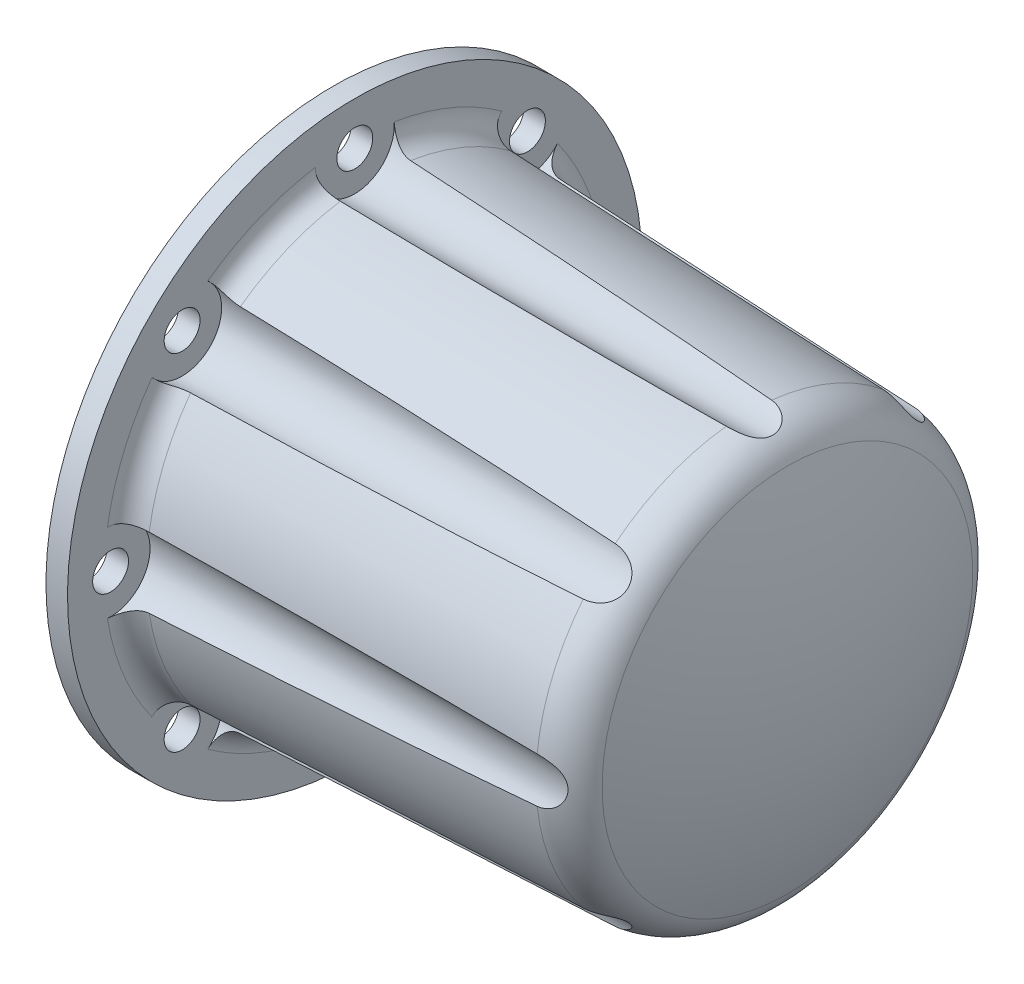
from build123d import *

# Parameters (mm, degrees)
ZAOKR_GLENIE1_R            = 3
SZKIC2_R                   = 5.5
WYTNIJ_WYCI_GNI_CIE1_DEPTH = 87.168439698
SZKIC3_R                   = 2.5
WYTNIJ_WYCI_GNI_CIE2_DEPTH = 87.168439698


with BuildPart() as part:
    # Szkic1 → Obrót1 (revolve)
    with BuildSketch(Plane.XY):
        with BuildLine():
            Line((-66, 26.5), (-10.994067388, 26.5))
            ThreePointArc((-10.994067388, 26.5), (-8.703534849, 25.77924697), (-7.238456444, 23.876730344))
            ThreePointArc((-7.238456444, 23.876730344), (-4.06783257, 12.125002732), (-3, 0))
            Line((-3, 0), (0, 0))
            ThreePointArc((0, 0), (-1.199413426, 13.121355623), (-4.757898357, 25.807795271))
            ThreePointArc((-4.757898357, 25.807795271), (-6.855963875, 28.536223134), (-10.108205234, 29.662777023))
            Line((-10.108205234, 29.662777023), (-65, 32))
            Line((-65, 32), (-65, 40))
            Line((-65, 40), (-68, 40))
            Line((-68, 40), (-68, 28.5))
            Line((-68, 28.5), (-66, 26.5))
        make_face()
    revolve(axis=Axis((-3, 0, 0), (1, 0, 0)))

    # Zaokrąglenie1
    zaokr_glenie1_edges = [part.edges().sort_by_distance(p)[0] for p in [
        (-65, -32, 0),
    ]]
    fillet(zaokr_glenie1_edges, radius=ZAOKR_GLENIE1_R)

    # Szkic2 → Wytnij-wyciągnięcie1 (cut, through all)
    with BuildSketch(Plane(origin=(-65, 0, 0), x_dir=(0, 0, -1), z_dir=(1, 0, 0))):
        with Locations((0, 34)):
            Circle(SZKIC2_R)
        with Locations((24.04163056, 24.04163056)):
            Circle(SZKIC2_R)
        with Locations((34, 0)):
            Circle(SZKIC2_R)
        with Locations((24.04163056, -24.04163056)):
            Circle(SZKIC2_R)
        with Locations((0, -34)):
            Circle(SZKIC2_R)
        with Locations((-24.04163056, -24.04163056)):
            Circle(SZKIC2_R)
        with Locations((-34, 0)):
            Circle(SZKIC2_R)
        with Locations((-24.04163056, 24.04163056)):
            Circle(SZKIC2_R)
    extrude(amount=WYTNIJ_WYCI_GNI_CIE1_DEPTH, mode=Mode.SUBTRACT)

    # Szkic3 → Wytnij-wyciągnięcie2 (cut, through all)
    with BuildSketch(Plane(origin=(-65, 0, 0), x_dir=(0, 0, -1), z_dir=(1, 0, 0))):
        with Locations((0, 34)):
            Circle(SZKIC3_R)
        with Locations((24.04163056, 24.04163056)):
            Circle(SZKIC3_R)
        with Locations((34, 0)):
            Circle(SZKIC3_R)
        with Locations((24.04163056, -24.04163056)):
            Circle(SZKIC3_R)
        with Locations((0, -34)):
            Circle(SZKIC3_R)
        with Locations((-24.04163056, -24.04163056)):
            Circle(SZKIC3_R)
        with Locations((-34, 0)):
            Circle(SZKIC3_R)
        with Locations((-24.04163056, 24.04163056)):
            Circle(SZKIC3_R)
    extrude(amount=-WYTNIJ_WYCI_GNI_CIE2_DEPTH, mode=Mode.SUBTRACT)


solid = part.part
